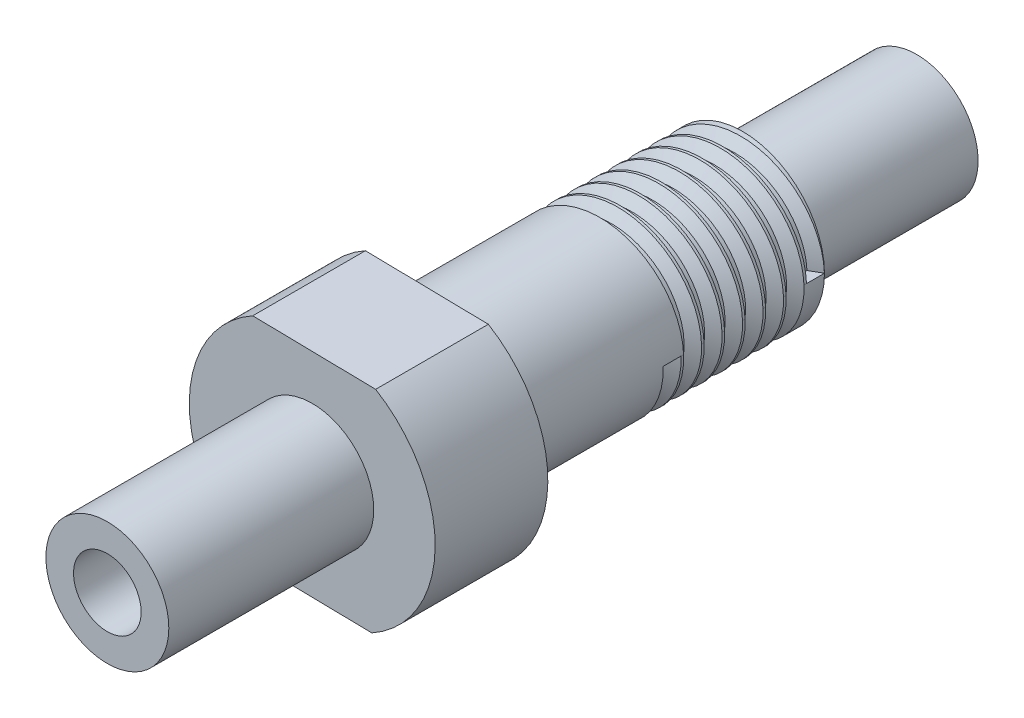
from build123d import *
from build123d.topology import SkipClean

# Parameters (mm, degrees)
SKETCH1_R                 = 4
BOSS_EXTRUDE1_DEPTH       = 16
SKETCH2_R                 = 6
BOSS_EXTRUDE2_DEPTH       = 8
SKETCH3_R                 = 3
BOSS_EXTRUDE3_DEPTH       = 9
BOSS_EXTRUDE4_START       = 9
SKETCH8_R                 = 3
BOSS_EXTRUDE4_DEPTH       = 9
M4X0_7_TAPPED_HOLE2_D     = 3.3
M4X0_7_TAPPED_HOLE2_DEPTH = 12
M4X0_7_TAPPED_HOLE2_TIP   = 0.991420021
M4X0_7_TAPPED_HOLE3_D     = 3.3
M4X0_7_TAPPED_HOLE3_DEPTH = 10
M4X0_7_TAPPED_HOLE3_TIP   = 0.991420021
CUT_EXTRUDE1_START        = -10
CUT_EXTRUDE1_DEPTH        = 10
SKETCH37_R                = 7.776269852
SKETCH37_R_2              = 3
CUT_EXTRUDE2_DEPTH        = 2.5
SKETCH38_R                = 3.744216795
SKETCH38_R_2              = 1.65
CUT_EXTRUDE3_DEPTH        = 2.5
SKETCH39_R                = 5.823427346
SKETCH39_R_2              = 1.65
CUT_EXTRUDE4_DEPTH        = 2
CUT_EXTRUDE5_START        = -7.5
SKETCH40_R                = 4.918694164
SKETCH40_R_2              = 3
CUT_EXTRUDE5_DEPTH        = 7.5
BOSS_EXTRUDE5_START       = -7.5
SKETCH42_R                = 4
SKETCH42_R_2              = 3
BOSS_EXTRUDE5_DEPTH       = 7.5
THREAD1_PITCH             = 1
SKETCH55_R                = 3
SKETCH55_R_2              = 1.65
BOSS_EXTRUDE6_DEPTH       = 1
BOSS_EXTRUDE7_START       = 1
SKETCH56_R                = 3
SKETCH56_R_2              = 1.65
BOSS_EXTRUDE7_DEPTH       = 1


with BuildPart() as part:
    # Sketch1 → Boss-Extrude1 (new body)
    with BuildSketch(Plane.XY):
        Circle(SKETCH1_R)
    extrude(amount=BOSS_EXTRUDE1_DEPTH)

    # Sketch2 → Boss-Extrude2 (add)
    with BuildSketch(Plane.XY.offset(16)):
        Circle(SKETCH2_R)
    extrude(amount=BOSS_EXTRUDE2_DEPTH)

    # Sketch3 → Boss-Extrude3 (add)
    with BuildSketch(Plane(origin=(0, 0, 0), x_dir=(-1, 0, 0), z_dir=(0, 0, -1))):
        Circle(SKETCH3_R)
    extrude(amount=BOSS_EXTRUDE3_DEPTH)

    # Sketch8 → Boss-Extrude4 (add)
    with BuildSketch(Plane.XY.offset(24).offset(BOSS_EXTRUDE4_START)):
        with Locations(Location((0, 0, 0), (0, 0, 180))):
            Circle(SKETCH8_R)
    extrude(amount=-BOSS_EXTRUDE4_DEPTH)

    # M4x0.7 Tapped Hole2
    with Locations(Plane.XY.offset(33)):
        with Locations((0, 0)):
            Hole(M4X0_7_TAPPED_HOLE2_D / 2, depth=M4X0_7_TAPPED_HOLE2_DEPTH)
            with Locations((0, 0, -(M4X0_7_TAPPED_HOLE2_DEPTH + M4X0_7_TAPPED_HOLE2_TIP / 2))):  # 118° drill point
                Cone(0, M4X0_7_TAPPED_HOLE2_D / 2, M4X0_7_TAPPED_HOLE2_TIP, mode=Mode.SUBTRACT)

    # M4x0.7 Tapped Hole3
    with Locations(Plane(origin=(0, 0, -9), x_dir=(-1, 0, 0), z_dir=(0, 0, -1))):
        with Locations((0, 0)):
            Hole(M4X0_7_TAPPED_HOLE3_D / 2, depth=M4X0_7_TAPPED_HOLE3_DEPTH)
            with Locations((0, 0, -(M4X0_7_TAPPED_HOLE3_DEPTH + M4X0_7_TAPPED_HOLE3_TIP / 2))):  # 118° drill point
                Cone(0, M4X0_7_TAPPED_HOLE3_D / 2, M4X0_7_TAPPED_HOLE3_TIP, mode=Mode.SUBTRACT)

    # Sketch36 → Cut-Extrude1 (cut)
    with BuildSketch(Plane.XY.offset(24).offset(CUT_EXTRUDE1_START)):
        with BuildLine():
            Line((-2.90430853, 5.250237325), (3.094684634, 5.140323629))
            ThreePointArc((3.094684634, 5.140323629), (0.109913695, 5.998993164), (-2.90430853, 5.250237325))
        make_face()
        with BuildLine():
            ThreePointArc((-3.094684634, -5.140323629), (-0.109913695, -5.998993164), (2.90430853, -5.250237325))
            Line((2.90430853, -5.250237325), (-3.094684634, -5.140323629))
        make_face()
    extrude(amount=CUT_EXTRUDE1_DEPTH, mode=Mode.SUBTRACT)

    # Sketch37 → Cut-Extrude2 (cut)
    with BuildSketch(Plane.XY.offset(24)):
        Circle(SKETCH37_R)
        with Locations(Location((0, 0, 0), (0, 0, 180))):
            Circle(SKETCH37_R_2, mode=Mode.SUBTRACT)
    extrude(amount=-CUT_EXTRUDE2_DEPTH, mode=Mode.SUBTRACT)

    # Sketch38 → Cut-Extrude3 (cut)
    with BuildSketch(Plane.XY.offset(33)):
        Circle(SKETCH38_R)
        with Locations(Location((0, 0, 0), (0, 0, 180))):
            Circle(SKETCH38_R_2, mode=Mode.SUBTRACT)
    extrude(amount=-CUT_EXTRUDE3_DEPTH, mode=Mode.SUBTRACT)

    # Sketch39 → Cut-Extrude4 (cut)
    with BuildSketch(Plane(origin=(0, 0, -9), x_dir=(-1, 0, 0), z_dir=(0, 0, -1))):
        Circle(SKETCH39_R)
        with Locations(Location((0, 0, 0), (0, 0, 180))):
            Circle(SKETCH39_R_2, mode=Mode.SUBTRACT)
    extrude(amount=-CUT_EXTRUDE4_DEPTH, mode=Mode.SUBTRACT)

    # Sketch40 → Cut-Extrude5 (cut)
    with BuildSketch(Plane(origin=(0, 0, -7), x_dir=(-1, 0, 0), z_dir=(0, 0, -1)).offset(CUT_EXTRUDE5_START)):
        Circle(SKETCH40_R)
        with Locations(Location((0, 0, 0), (0, 0, 180))):
            Circle(SKETCH40_R_2, mode=Mode.SUBTRACT)
    extrude(amount=CUT_EXTRUDE5_DEPTH, mode=Mode.SUBTRACT)

    # Sketch42 → Boss-Extrude5 (add)
    with BuildSketch(Plane(origin=(0, 0, 0.5), x_dir=(-1, 0, 0), z_dir=(0, 0, -1)).offset(BOSS_EXTRUDE5_START)):
        Circle(SKETCH42_R)
        with Locations(Location((0, 0, 0), (0, 0, 180))):
            Circle(SKETCH42_R_2, mode=Mode.SUBTRACT)
    extrude(amount=BOSS_EXTRUDE5_DEPTH)

    # Thread1: the profile of Thread Profile5 profile screwed along a right-hand helix of 7 turns, 8 arcs to a turn; built about Z, then put on its axis
    thread1_z = Axis((0, 0, 0), (0, 0, 1))
    thread1_corners = [(4.0003, 0, -0.000173205), (4.0003, 0, 0.875173202), (3.458734125, 0, 0.562499999), (3.458734125, 0, 0.312499999)]
    with BuildLine(mode=Mode.PRIVATE) as thread1_profile:
        Line(thread1_corners[0], thread1_corners[1])
        Line(thread1_corners[1], thread1_corners[2])
        Line(thread1_corners[2], thread1_corners[3])
        Line(thread1_corners[3], thread1_corners[0])
    thread1_cap = Face(thread1_profile.wire())
    thread1_turn_angles = [0, 22.5, 45, 67.5, 90, 112.5, 135, 157.5, 180, 202.5, 225, 247.5, 270, 292.5, 315, 337.5, 360]
    thread1_turn_weights = [1, 0.9238795325112867, 1, 0.9238795325112867, 1, 0.9238795325112867, 1, 0.9238795325112867, 1, 0.9238795325112867, 1, 0.9238795325112867, 1, 0.9238795325112867, 1, 0.9238795325112867, 1]
    thread1_turn_rails = [Edge.make_bspline([Vector(p[0], p[1], 0).rotate(thread1_z, thread1_turn_angles[k]) / thread1_turn_weights[k] + Vector(0, 0, p[2] + THREAD1_PITCH * thread1_turn_angles[k] / 360) for k in range(17)], [0, 0, 0, 1, 1, 2, 2, 3, 3, 4, 4, 5, 5, 6, 6, 7, 7, 8, 8, 8], 2, thread1_turn_weights) for p in thread1_corners]
    thread1_turn_sides = [Face.make_surface_from_curves(thread1_turn_rails[p[0]], thread1_turn_rails[p[1]]) for p in [(0, 1), (1, 2), (2, 3), (3, 0)]]
    thread1 = Plane(origin=(0, 0, 0.5), x_dir=(1, 0, 0), z_dir=(0, 0, 1)) * Solid(Shell([*[p.moved(Location((0, 0, THREAD1_PITCH * i))) for i in range(7) for p in thread1_turn_sides], thread1_cap, thread1_cap.rotate(thread1_z, 2520).moved(Location((0, 0, THREAD1_PITCH * 2520 / 360)))]))
    add(thread1, mode=Mode.SUBTRACT)

    # Sketch55 → Boss-Extrude6 (add)
    with BuildSketch(Plane(origin=(0, 0, -7), x_dir=(-1, 0, 0), z_dir=(0, 0, -1))):
        with Locations(Location((0, 0, 0), (0, 0, 180))):
            Circle(SKETCH55_R)
        with Locations(Location((0, 0, 0), (0, 0, 180))):
            Circle(SKETCH55_R_2, mode=Mode.SUBTRACT)
    extrude(amount=BOSS_EXTRUDE6_DEPTH)

    # Sketch56 → Boss-Extrude7 (add)
    with SkipClean():  # the faces are left unmerged after this step: merging them gives an invalid solid
        with BuildSketch(Plane.XY.offset(30.5).offset(BOSS_EXTRUDE7_START)):
            Circle(SKETCH56_R)
            with Locations(Location((0, 0, 0), (0, 0, 180))):
                Circle(SKETCH56_R_2, mode=Mode.SUBTRACT)
        extrude(amount=-BOSS_EXTRUDE7_DEPTH)
    add(part.part.scale(1), mode=Mode.REPLACE)  # the faces are merged on a copy


solid = part.part
